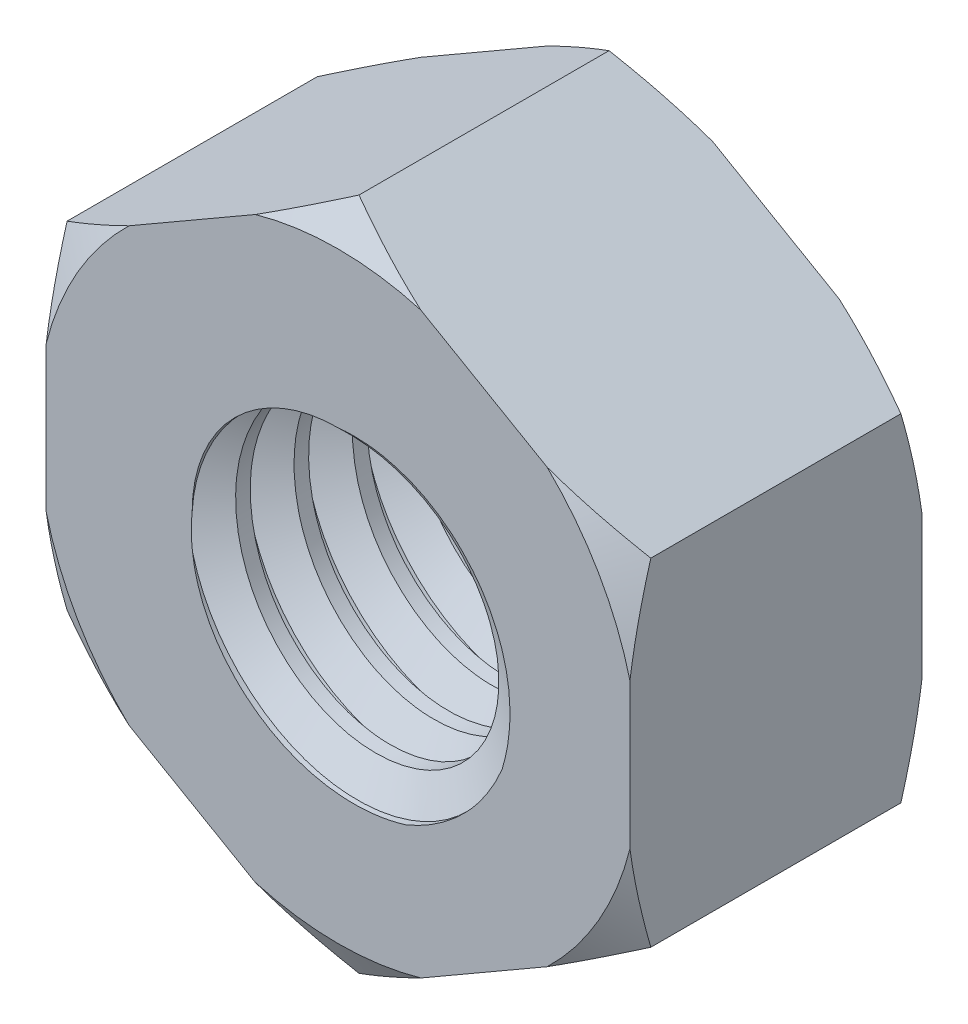
from build123d import *

# Parameters (mm, degrees)
CROQUIS1_R              = 2.5
SALIENTE_EXTRUIR1_DEPTH = 2.5
ROSCA3_PITCH            = 1


with BuildPart() as part:
    # Croquis1 → Saliente-Extruir1 (new, symmetric)
    with BuildSketch(Plane.XY):
        Polygon((0, 5.773502692), (-5, 2.886751346), (-5, -2.886751346), (0, -5.773502692), (5, -2.886751346), (5, 2.886751346), align=None)
        Circle(CROQUIS1_R, mode=Mode.SUBTRACT)
    extrude(amount=SALIENTE_EXTRUIR1_DEPTH, both=True)

    # Croquis2 → Cortar-Revolución1 (revolve, cut)
    with BuildSketch(Plane(origin=(0, 0, 0), x_dir=(0, 0, -1), z_dir=(1, 0, 0))):
        Polygon((-2.142042833, 5.773502692), (-2.5, 5.153502692), (-2.5, 5.773502692), align=None)
    cortar_revoluci_n1 = revolve(axis=Axis((0, 0, 2.5), (0, 0, -1)), mode=Mode.SUBTRACT)

    # Rosca3: the profile of Perfil de rosca4 profile screwed along a right-hand helix of 6 turns, 8 arcs to a turn; built about Z, then put on its axis
    rosca3_z = Axis((0, 0, 0), (0, 0, 1))
    rosca3_corners = [(2.4997, 0, -0.000173205), (3.041265875, 0, 0.312499999), (3.041265875, 0, 0.437499999), (2.4997, 0, 0.750173202)]
    with BuildLine(mode=Mode.PRIVATE) as rosca3_profile:
        Line(rosca3_corners[0], rosca3_corners[1])
        Line(rosca3_corners[1], rosca3_corners[2])
        Line(rosca3_corners[2], rosca3_corners[3])
        Line(rosca3_corners[3], rosca3_corners[0])
    rosca3_cap = Face(rosca3_profile.wire())
    rosca3_turn_angles = [0, 22.5, 45, 67.5, 90, 112.5, 135, 157.5, 180, 202.5, 225, 247.5, 270, 292.5, 315, 337.5, 360]
    rosca3_turn_weights = [1, 0.9238795325112867, 1, 0.9238795325112867, 1, 0.9238795325112867, 1, 0.9238795325112867, 1, 0.9238795325112867, 1, 0.9238795325112867, 1, 0.9238795325112867, 1, 0.9238795325112867, 1]
    rosca3_turn_rails = [Edge.make_bspline([Vector(p[0], p[1], 0).rotate(rosca3_z, rosca3_turn_angles[k]) / rosca3_turn_weights[k] + Vector(0, 0, p[2] + ROSCA3_PITCH * rosca3_turn_angles[k] / 360) for k in range(17)], [0, 0, 0, 1, 1, 2, 2, 3, 3, 4, 4, 5, 5, 6, 6, 7, 7, 8, 8, 8], 2, rosca3_turn_weights) for p in rosca3_corners]
    rosca3_turn_sides = [Face.make_surface_from_curves(rosca3_turn_rails[p[0]], rosca3_turn_rails[p[1]]) for p in [(0, 1), (1, 2), (2, 3), (3, 0)]]
    rosca3 = Plane(origin=(0, 0, 3.5), x_dir=(-1, 0, 0), z_dir=(0, 0, -1)) * Solid(Shell([*[p.moved(Location((0, 0, ROSCA3_PITCH * i))) for i in range(6) for p in rosca3_turn_sides], rosca3_cap, rosca3_cap.rotate(rosca3_z, 2160).moved(Location((0, 0, ROSCA3_PITCH * 2160 / 360)))]))
    add(rosca3, mode=Mode.SUBTRACT)

    # Simetría1: Cortar-Revolución1 across plane
    add(cortar_revoluci_n1.mirror(Plane.XY), mode=Mode.SUBTRACT)


solid = part.part
